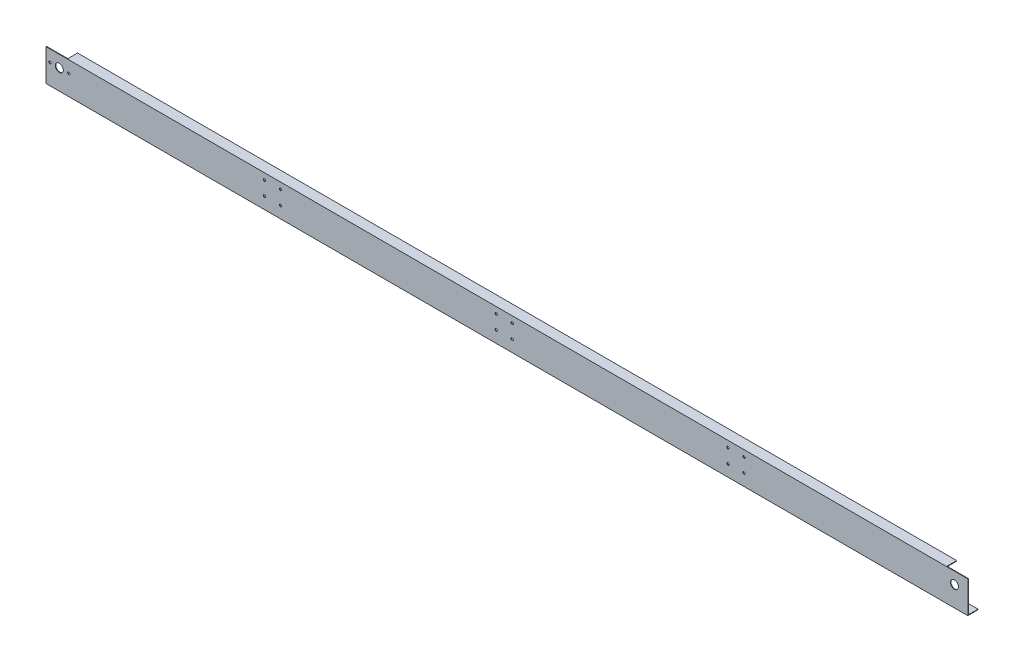
from build123d import *

# Parameters (mm, degrees)
BOSS_EXTRUDE1_DEPTH = 4394.2
CUT_EXTRUDE1_REACH  = 4398.278
SKETCH2_R           = 19.05
SKETCH2_R_2         = 5.55625
CUT_EXTRUDE4_REACH  = 4398.278
SKETCH3_W           = 101.6
SKETCH3_H           = 2.54
CUT_EXTRUDE5_REACH  = 4398.278
SKETCH4_R           = 5.55625


with BuildPart() as part:
    # Sketch1 → Boss-Extrude1 (new body)
    with BuildSketch(Plane(origin=(0, 0, 0), x_dir=(0, 0, -1), z_dir=(1, 0, 0))):
        Polygon((0, 0), (0, 127), (48.768, 127), (48.768, 124.46), (2.54, 124.46), (2.54, 2.54), (2.54, -22.86), (48.768, -22.86), (48.768, -25.4), (0, -25.4), align=None)
    extrude(amount=BOSS_EXTRUDE1_DEPTH)

    # Sketch2 → Cut-Extrude1 (cut, up to next)
    with BuildSketch(Plane(origin=(0, 0, -2.54), x_dir=(-1, 0, 0), z_dir=(0, 0, -1)), mode=Mode.PRIVATE) as cut_extrude1_sk1:
        with Locations((-4330.7, 71.12)):
            Circle(SKETCH2_R)
    cut_extrude1_tool1 = extrude(cut_extrude1_sk1.sketch, amount=-CUT_EXTRUDE1_REACH, mode=Mode.PRIVATE) & part.part
    # Sketch2 → Cut-Extrude1 (cut, up to next)
    with BuildSketch(Plane(origin=(0, 0, -2.54), x_dir=(-1, 0, 0), z_dir=(0, 0, -1)), mode=Mode.PRIVATE) as cut_extrude1_sk2:
        with Locations((-63.5, 71.12)):
            Circle(SKETCH2_R)
    cut_extrude1_tool2 = extrude(cut_extrude1_sk2.sketch, amount=-CUT_EXTRUDE1_REACH, mode=Mode.PRIVATE) & part.part
    # Sketch2 → Cut-Extrude1 (cut, up to next)
    with BuildSketch(Plane(origin=(0, 0, -2.54), x_dir=(-1, 0, 0), z_dir=(0, 0, -1)), mode=Mode.PRIVATE) as cut_extrude1_sk3:
        with Locations((-18.4546875, 71.12)):
            Circle(SKETCH2_R_2)
    cut_extrude1_tool3 = extrude(cut_extrude1_sk3.sketch, amount=-CUT_EXTRUDE1_REACH, mode=Mode.PRIVATE) & part.part
    # Sketch2 → Cut-Extrude1 (cut, up to next)
    with BuildSketch(Plane(origin=(0, 0, -2.54), x_dir=(-1, 0, 0), z_dir=(0, 0, -1)), mode=Mode.PRIVATE) as cut_extrude1_sk4:
        with Locations((-108.5453125, 71.12)):
            Circle(SKETCH2_R_2)
    cut_extrude1_tool4 = extrude(cut_extrude1_sk4.sketch, amount=-CUT_EXTRUDE1_REACH, mode=Mode.PRIVATE) & part.part
    add(cut_extrude1_tool1.solids().sort_by_distance((4330.7, 71.12, -2.54))[0], mode=Mode.SUBTRACT)
    add(cut_extrude1_tool2.solids().sort_by_distance((63.5, 71.12, -2.54))[0], mode=Mode.SUBTRACT)
    add(cut_extrude1_tool3.solids().sort_by_distance((18.454688, 71.12, -2.54))[0], mode=Mode.SUBTRACT)
    add(cut_extrude1_tool4.solids().sort_by_distance((108.545313, 71.12, -2.54))[0], mode=Mode.SUBTRACT)

    # Sketch3 → Cut-Extrude4 (cut, up to next)
    with BuildSketch(Plane(origin=(0, 0, -2.54), x_dir=(-1, 0, 0), z_dir=(0, 0, -1)), mode=Mode.PRIVATE) as cut_extrude4_sk1:
        with Locations((-4343.4, 125.73)):
            Rectangle(SKETCH3_W, SKETCH3_H)
    cut_extrude4_tool1 = extrude(cut_extrude4_sk1.sketch, amount=CUT_EXTRUDE4_REACH, mode=Mode.PRIVATE) & part.part
    # Sketch3 → Cut-Extrude4 (cut, up to next)
    with BuildSketch(Plane(origin=(0, 0, -2.54), x_dir=(-1, 0, 0), z_dir=(0, 0, -1)), mode=Mode.PRIVATE) as cut_extrude4_sk2:
        with Locations((-50.8, 125.73)):
            Rectangle(SKETCH3_W, SKETCH3_H)
    cut_extrude4_tool2 = extrude(cut_extrude4_sk2.sketch, amount=CUT_EXTRUDE4_REACH, mode=Mode.PRIVATE) & part.part
    add(cut_extrude4_tool1.solids().sort_by_distance((4343.4, 125.73, -2.54))[0], mode=Mode.SUBTRACT)
    add(cut_extrude4_tool2.solids().sort_by_distance((50.8, 125.73, -2.54))[0], mode=Mode.SUBTRACT)

    # Sketch4 → Cut-Extrude5 (cut, up to next)
    with BuildSketch(Plane(origin=(0, 0, -2.54), x_dir=(-1, 0, 0), z_dir=(0, 0, -1)), mode=Mode.PRIVATE) as cut_extrude5_sk1:
        with Locations((-3327.4, 96.774)):
            Circle(SKETCH4_R)
    cut_extrude5_tool1 = extrude(cut_extrude5_sk1.sketch, amount=-CUT_EXTRUDE5_REACH, mode=Mode.PRIVATE) & part.part
    # Sketch4 → Cut-Extrude5 (cut, up to next)
    with BuildSketch(Plane(origin=(0, 0, -2.54), x_dir=(-1, 0, 0), z_dir=(0, 0, -1)), mode=Mode.PRIVATE) as cut_extrude5_sk2:
        with Locations((-3251.2, 96.774)):
            Circle(SKETCH4_R)
    cut_extrude5_tool2 = extrude(cut_extrude5_sk2.sketch, amount=-CUT_EXTRUDE5_REACH, mode=Mode.PRIVATE) & part.part
    # Sketch4 → Cut-Extrude5 (cut, up to next)
    with BuildSketch(Plane(origin=(0, 0, -2.54), x_dir=(-1, 0, 0), z_dir=(0, 0, -1)), mode=Mode.PRIVATE) as cut_extrude5_sk3:
        with Locations((-3251.2, 30.226)):
            Circle(SKETCH4_R)
    cut_extrude5_tool3 = extrude(cut_extrude5_sk3.sketch, amount=-CUT_EXTRUDE5_REACH, mode=Mode.PRIVATE) & part.part
    # Sketch4 → Cut-Extrude5 (cut, up to next)
    with BuildSketch(Plane(origin=(0, 0, -2.54), x_dir=(-1, 0, 0), z_dir=(0, 0, -1)), mode=Mode.PRIVATE) as cut_extrude5_sk4:
        with Locations((-3327.4, 30.226)):
            Circle(SKETCH4_R)
    cut_extrude5_tool4 = extrude(cut_extrude5_sk4.sketch, amount=-CUT_EXTRUDE5_REACH, mode=Mode.PRIVATE) & part.part
    # Sketch4 → Cut-Extrude5 (cut, up to next)
    with BuildSketch(Plane(origin=(0, 0, -2.54), x_dir=(-1, 0, 0), z_dir=(0, 0, -1)), mode=Mode.PRIVATE) as cut_extrude5_sk5:
        with Locations((-2222.5, 96.774)):
            Circle(SKETCH4_R)
    cut_extrude5_tool5 = extrude(cut_extrude5_sk5.sketch, amount=-CUT_EXTRUDE5_REACH, mode=Mode.PRIVATE) & part.part
    # Sketch4 → Cut-Extrude5 (cut, up to next)
    with BuildSketch(Plane(origin=(0, 0, -2.54), x_dir=(-1, 0, 0), z_dir=(0, 0, -1)), mode=Mode.PRIVATE) as cut_extrude5_sk6:
        with Locations((-2146.3, 96.774)):
            Circle(SKETCH4_R)
    cut_extrude5_tool6 = extrude(cut_extrude5_sk6.sketch, amount=-CUT_EXTRUDE5_REACH, mode=Mode.PRIVATE) & part.part
    # Sketch4 → Cut-Extrude5 (cut, up to next)
    with BuildSketch(Plane(origin=(0, 0, -2.54), x_dir=(-1, 0, 0), z_dir=(0, 0, -1)), mode=Mode.PRIVATE) as cut_extrude5_sk7:
        with Locations((-2146.3, 30.226)):
            Circle(SKETCH4_R)
    cut_extrude5_tool7 = extrude(cut_extrude5_sk7.sketch, amount=-CUT_EXTRUDE5_REACH, mode=Mode.PRIVATE) & part.part
    # Sketch4 → Cut-Extrude5 (cut, up to next)
    with BuildSketch(Plane(origin=(0, 0, -2.54), x_dir=(-1, 0, 0), z_dir=(0, 0, -1)), mode=Mode.PRIVATE) as cut_extrude5_sk8:
        with Locations((-2222.5, 30.226)):
            Circle(SKETCH4_R)
    cut_extrude5_tool8 = extrude(cut_extrude5_sk8.sketch, amount=-CUT_EXTRUDE5_REACH, mode=Mode.PRIVATE) & part.part
    # Sketch4 → Cut-Extrude5 (cut, up to next)
    with BuildSketch(Plane(origin=(0, 0, -2.54), x_dir=(-1, 0, 0), z_dir=(0, 0, -1)), mode=Mode.PRIVATE) as cut_extrude5_sk9:
        with Locations((-1117.6, 96.774)):
            Circle(SKETCH4_R)
    cut_extrude5_tool9 = extrude(cut_extrude5_sk9.sketch, amount=-CUT_EXTRUDE5_REACH, mode=Mode.PRIVATE) & part.part
    # Sketch4 → Cut-Extrude5 (cut, up to next)
    with BuildSketch(Plane(origin=(0, 0, -2.54), x_dir=(-1, 0, 0), z_dir=(0, 0, -1)), mode=Mode.PRIVATE) as cut_extrude5_sk10:
        with Locations((-1041.4, 96.774)):
            Circle(SKETCH4_R)
    cut_extrude5_tool10 = extrude(cut_extrude5_sk10.sketch, amount=-CUT_EXTRUDE5_REACH, mode=Mode.PRIVATE) & part.part
    # Sketch4 → Cut-Extrude5 (cut, up to next)
    with BuildSketch(Plane(origin=(0, 0, -2.54), x_dir=(-1, 0, 0), z_dir=(0, 0, -1)), mode=Mode.PRIVATE) as cut_extrude5_sk11:
        with Locations((-1041.4, 30.226)):
            Circle(SKETCH4_R)
    cut_extrude5_tool11 = extrude(cut_extrude5_sk11.sketch, amount=-CUT_EXTRUDE5_REACH, mode=Mode.PRIVATE) & part.part
    # Sketch4 → Cut-Extrude5 (cut, up to next)
    with BuildSketch(Plane(origin=(0, 0, -2.54), x_dir=(-1, 0, 0), z_dir=(0, 0, -1)), mode=Mode.PRIVATE) as cut_extrude5_sk12:
        with Locations((-1117.6, 30.226)):
            Circle(SKETCH4_R)
    cut_extrude5_tool12 = extrude(cut_extrude5_sk12.sketch, amount=-CUT_EXTRUDE5_REACH, mode=Mode.PRIVATE) & part.part
    add(cut_extrude5_tool1.solids().sort_by_distance((3327.4, 96.774, -2.54))[0], mode=Mode.SUBTRACT)
    add(cut_extrude5_tool2.solids().sort_by_distance((3251.2, 96.774, -2.54))[0], mode=Mode.SUBTRACT)
    add(cut_extrude5_tool3.solids().sort_by_distance((3251.2, 30.226, -2.54))[0], mode=Mode.SUBTRACT)
    add(cut_extrude5_tool4.solids().sort_by_distance((3327.4, 30.226, -2.54))[0], mode=Mode.SUBTRACT)
    add(cut_extrude5_tool5.solids().sort_by_distance((2222.5, 96.774, -2.54))[0], mode=Mode.SUBTRACT)
    add(cut_extrude5_tool6.solids().sort_by_distance((2146.3, 96.774, -2.54))[0], mode=Mode.SUBTRACT)
    add(cut_extrude5_tool7.solids().sort_by_distance((2146.3, 30.226, -2.54))[0], mode=Mode.SUBTRACT)
    add(cut_extrude5_tool8.solids().sort_by_distance((2222.5, 30.226, -2.54))[0], mode=Mode.SUBTRACT)
    add(cut_extrude5_tool9.solids().sort_by_distance((1117.6, 96.774, -2.54))[0], mode=Mode.SUBTRACT)
    add(cut_extrude5_tool10.solids().sort_by_distance((1041.4, 96.774, -2.54))[0], mode=Mode.SUBTRACT)
    add(cut_extrude5_tool11.solids().sort_by_distance((1041.4, 30.226, -2.54))[0], mode=Mode.SUBTRACT)
    add(cut_extrude5_tool12.solids().sort_by_distance((1117.6, 30.226, -2.54))[0], mode=Mode.SUBTRACT)


solid = part.part
